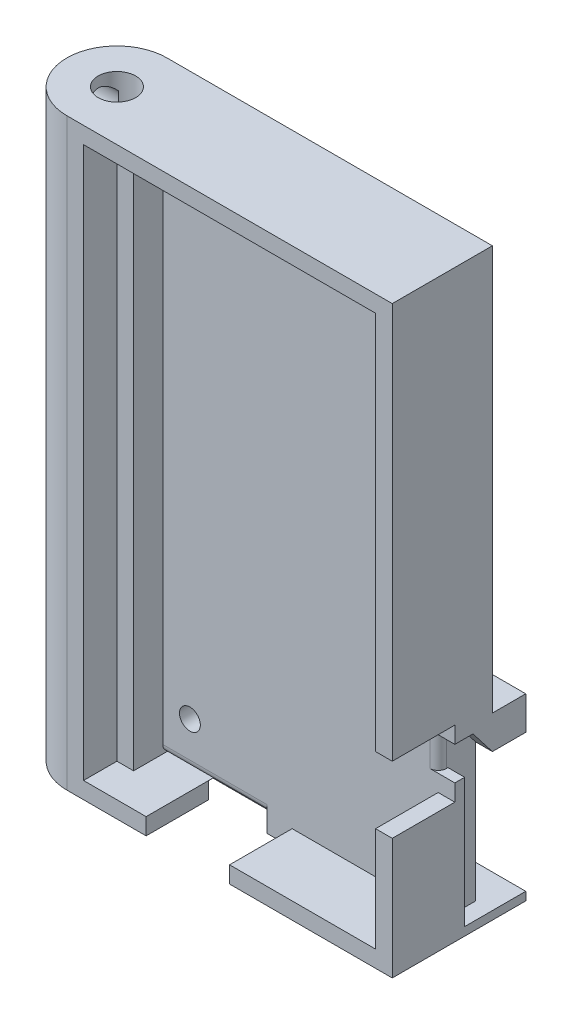
from build123d import *

# Parameters (mm, degrees)
SKETCH1_W                = 39
SKETCH1_H                = 70
BASE_DEPTH               = 4.5
SKETCH2_W                = 4
SKETCH2_H                = 62
WALLS_DEPTH              = 7.5
SKETCH3_W                = 10
SKETCH3_H                = 7.5
PWR_CONNECTOR_HOLE_DEPTH = 4
SKETCH4_W                = 7.5
SKETCH4_H                = 8
GPS_CONNECTOR_HOLE_DEPTH = 4
SKETCH5_R                = 1.25
MOUNTING_HOLES_DEPTH     = 4
GPS_MOUNT_DEPTH          = 4
SKETCH11_W               = 17
SKETCH11_H               = 1
SKETCH11_W_2             = 12
SKETCH11_H_2             = 3
PWR_CABLE_HOLDER1_DEPTH  = 4
PWR_FILLET2_R            = 1
PWR_FILLET3_R            = 0.5
SKETCH15_R               = 6
BALLON_MOUNT_DEPTH       = 70
SKETCH16_R               = 2.25
BALLOON_MOUNT_HOLE_DEPTH = 70
SKETCH21_R               = 2.25
SAFETY_MOUNT_DEPTH       = 4.5
SKETCH22_W               = 35
SKETCH22_H               = 66
LID_HOLE_DEPTH           = 7.5
SKETCH25_W               = 3.5
SKETCH25_H               = 66
CORRECTION_DEPTH         = 2
FILLET4_R                = 0.75
FILLET5_R                = 1
SKETCH12_W               = 7
SKETCH12_H               = 2.5
SKETCH12_W_2             = 2
SKETCH12_H_2             = 2
CUT_EXTRUDE2_DEPTH       = 1.99
SKETCH13_W               = 2.326586719
SKETCH13_H               = 10
CUT_EXTRUDE3_DEPTH       = 2
FILLET6_R                = 1
FILLET7_R                = 1
FILLET8_START            = 4
FILLET8_DEPTH            = 12.5
FILLET8_START_2          = 9.5
FILLET8_2_DEPTH          = 7


with BuildPart() as part:
    # Sketch1 → Base (new body)
    with BuildSketch(Plane.XY):
        with Locations((19.5, 35)):
            Rectangle(SKETCH1_W, SKETCH1_H)
    extrude(amount=BASE_DEPTH)

    # Sketch2 → Walls (add)
    with BuildSketch(Plane.XY.offset(4.5)):
        Polygon((39, 66), (39, 70), (0, 70), (0, 66), (4, 66), (35, 66), align=None)
        with Locations((37, 35)):
            Rectangle(SKETCH2_W, SKETCH2_H)
        Polygon((4, 66), (0, 66), (0, 0), (4, 0), (4, 4), align=None)
        Polygon((39, 0), (39, 4), (35, 4), (4, 4), (4, 0), align=None)
    extrude(amount=WALLS_DEPTH)

    # Sketch3 → PWR connector hole (cut)
    with BuildSketch(Plane(origin=(0, 4, 0), x_dir=(1, 0, 0), z_dir=(0, 1, 0))):
        with Locations((14.5, -8.25)):
            Rectangle(SKETCH3_W, SKETCH3_H)
    extrude(amount=-PWR_CONNECTOR_HOLE_DEPTH, mode=Mode.SUBTRACT)

    # Sketch4 → GPS connector hole (cut)
    with BuildSketch(Plane.ZY.offset(-35)):
        with Locations((8.25, 18.5)):
            Rectangle(SKETCH4_W, SKETCH4_H)
    extrude(amount=-GPS_CONNECTOR_HOLE_DEPTH, mode=Mode.SUBTRACT)

    # Sketch5 → Mounting holes (cut)
    with BuildSketch(Plane.XY.offset(4.5)):
        with Locations((7.25, 7.25)):
            Circle(SKETCH5_R)
        with Locations(Location((31.75, 7.25, 0), (0, 0, 180))):
            Circle(SKETCH5_R)
        with Locations(Location((7.25, 62.75, 0), (0, 0, 180))):
            Circle(SKETCH5_R)
    extrude(amount=-MOUNTING_HOLES_DEPTH, mode=Mode.SUBTRACT)

    # Sketch7 → GPS mount (add)
    with BuildSketch(Plane(origin=(0, 0, 0), x_dir=(-1, 0, 0), z_dir=(0, 0, -1))):
        Polygon((-39, 1), (-39, 0), (-7, 0), (-7, 18.5), (-39, 18.5), (-39, 17.5), (-8, 17.5), (-8, 1), align=None)
    extrude(amount=GPS_MOUNT_DEPTH)

    # Sketch11 → PWR cable holder1 (add)
    with BuildSketch(Plane(origin=(0, 0, 0), x_dir=(-1, 0, 0), z_dir=(0, 0, -1))):
        Polygon((-5, 0), (-3, 0), (-3, 21.5), (-5, 21.5), (-5, 20.5), align=None)
        with Locations((-13.5, 21)):
            Rectangle(SKETCH11_W, SKETCH11_H)
        with Locations((-33, 20)):
            Rectangle(SKETCH11_W_2, SKETCH11_H_2)
    extrude(amount=PWR_CABLE_HOLDER1_DEPTH)

    # PWR fillet2
    pwr_fillet2_edges = [part.edges().sort_by_distance(p)[0] for p in [
        (27, 21.5, -2),
    ]]
    fillet(pwr_fillet2_edges, radius=PWR_FILLET2_R)

    # PWR fillet3
    pwr_fillet3_edges = [part.edges().sort_by_distance(p)[0] for p in [
        (22, 21.5, -2),
        (22, 20.5, -2),
    ]]
    fillet(pwr_fillet3_edges, radius=PWR_FILLET3_R - 0.0001)  # a hair under: the kernel refuses the full size

    # Sketch15 → Ballon mount (add)
    with BuildSketch(Plane.XZ):
        with Locations((0, 6)):
            Circle(SKETCH15_R)
    extrude(amount=-BALLON_MOUNT_DEPTH)

    # Sketch16 → Balloon mount hole (cut)
    with BuildSketch(Plane.XZ):
        with Locations(Location((0, 6, 0), (0, 0, 270))):
            Circle(SKETCH16_R)
    extrude(amount=-BALLOON_MOUNT_HOLE_DEPTH, mode=Mode.SUBTRACT)

    # Sketch21 → Safety mount (cut)
    with BuildSketch(Plane.ZY.offset(6)):
        with Locations((6, 3.5)):
            Circle(SKETCH21_R)
        with Locations((6, 66.5)):
            Circle(SKETCH21_R)
    extrude(amount=-SAFETY_MOUNT_DEPTH, mode=Mode.SUBTRACT)

    # Sketch22 → Lid hole (cut)
    with BuildSketch(Plane.XY.offset(12)):
        with Locations((19.5, 35)):
            Rectangle(SKETCH22_W, SKETCH22_H)
    extrude(amount=-LID_HOLE_DEPTH, mode=Mode.SUBTRACT)

    # Sketch25 → Correction (add)
    with BuildSketch(Plane(origin=(2, 0, 0), x_dir=(0, 0, -1), z_dir=(1, 0, 0))):
        with Locations((-6.25, 35)):
            Rectangle(SKETCH25_W, SKETCH25_H)
    extrude(amount=CORRECTION_DEPTH)

    # Fillet4
    fillet4_edges = [part.edges().sort_by_distance(p)[0] for p in [
        (7, 18.5, -2),
    ]]
    fillet(fillet4_edges, radius=FILLET4_R)

    # Fillet5
    fillet5_edges = [part.edges().sort_by_distance(p)[0] for p in [
        (5, 20.5, -2),
    ]]
    fillet(fillet5_edges, radius=FILLET5_R)

    # Sketch12 → Cut-Extrude2 (cut)
    with BuildSketch(Plane.XZ):
        with Locations((13, 3.25)):
            Rectangle(SKETCH12_W, SKETCH12_H)
        Polygon((5, 4.5), (5, 2), (7, 2), (9.5, 2), (9.5, 4.5), align=None)
        with Locations((6, 1)):
            Rectangle(SKETCH12_W_2, SKETCH12_H_2)
    extrude(amount=-CUT_EXTRUDE2_DEPTH, mode=Mode.SUBTRACT)

    # Sketch13 → Cut-Extrude3 (cut)
    with BuildSketch(Plane(origin=(39, 0, 0), x_dir=(0, 0, -1), z_dir=(1, 0, 0))):
        Polygon((-2.326586719, 20.5), (-4.5, 20.5), (-4.5, 16.5), (-3.326586719, 16.5), (-2.326586719, 16.5), (-2.326586719, 17.5), align=None)
        Polygon((0, 17.5), (-2.326586719, 20.5), (-2.326586719, 17.5), align=None)
        Polygon((0, 17.5), (-2.326586719, 17.5), (-2.326586719, 16.5), (-2.326586719, 11), (0, 11), align=None)
        Polygon((-2.326586719, 16.5), (-3.326586719, 16.5), (-3.326586719, 1), (-2.326586719, 1), (-2.326586719, 11), align=None)
        with Locations((-1.16329336, 6)):
            Rectangle(SKETCH13_W, SKETCH13_H)
    extrude(amount=-CUT_EXTRUDE3_DEPTH, mode=Mode.SUBTRACT)

    # Fillet6
    fillet6_edges = [part.edges().sort_by_distance(p)[0] for p in [
        (37, 18.5, 4.5),
    ]]
    fillet(fillet6_edges, radius=FILLET6_R)

    # Fillet7
    fillet7_edges = [part.edges().sort_by_distance(p)[0] for p in [
        (6, 1.99, 0),
    ]]
    fillet(fillet7_edges, radius=FILLET7_R)

    # Fillet8: read off the stored shape, not the designer's step
    # Fillet8 outline → Fillet8 (cut)
    with BuildSketch(Plane.YZ.offset(FILLET8_START)):
        with BuildLine():
            Line((2.99, 4.5), (2, 4.5))
            Line((2, 4.5), (2, 3.64106736))
            ThreePointArc((2, 3.64106736), (2.334663201, 4.255336799), (2.99, 4.5))
        make_face()
    extrude(amount=FILLET8_DEPTH, mode=Mode.SUBTRACT)

    # Fillet8 2 outline → Fillet8 2 (cut)
    with BuildSketch(Plane.YZ.offset(FILLET8_START_2)):
        with BuildLine():
            Line((2, 3.64106736), (2, 4.5))
            Line((2, 4.5), (1.99, 4.5))
            Line((1.99, 4.5), (1.99, 3.5))
            ThreePointArc((1.99, 3.5), (1.992503133, 3.570710678), (2, 3.64106736))
        make_face()
    extrude(amount=FILLET8_2_DEPTH, mode=Mode.SUBTRACT)


solid = part.part
